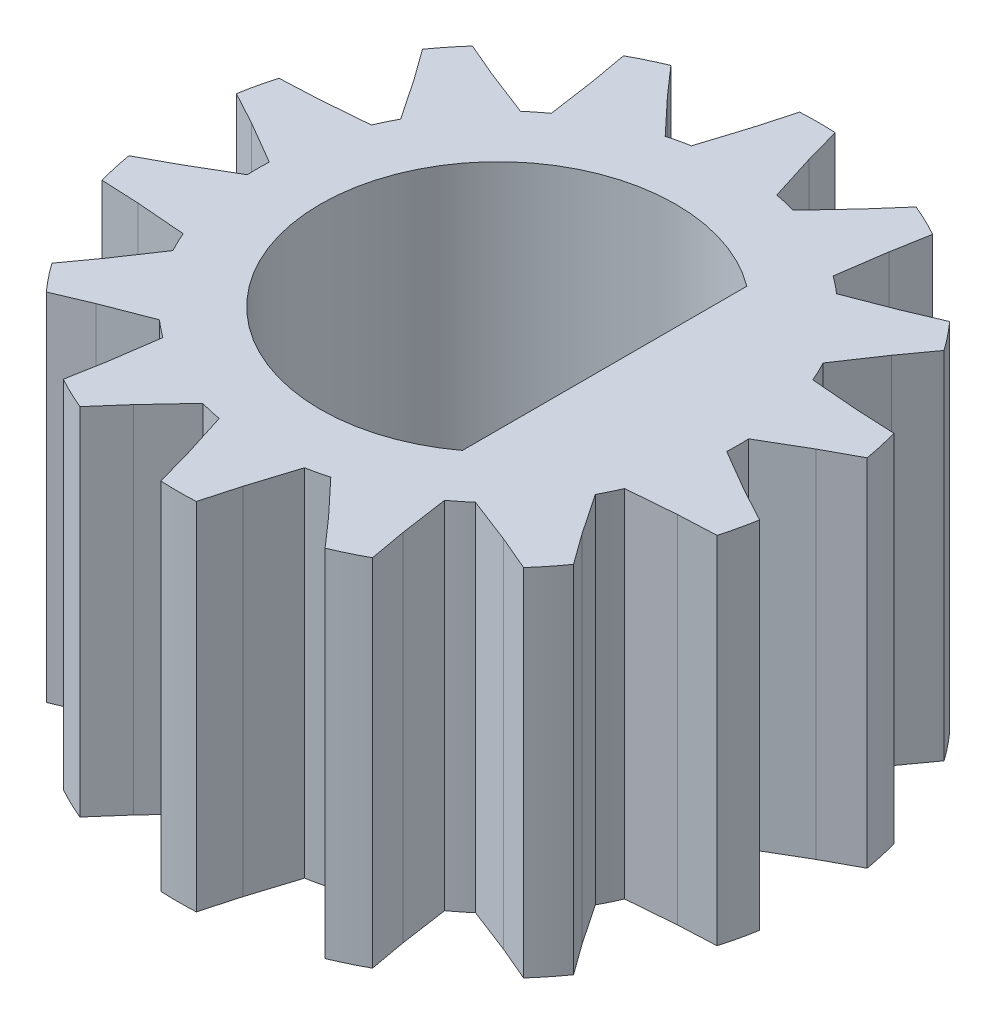
from build123d import *

# Parameters (mm, degrees)
BOSS_EXTRUDE1_DEPTH = 5
CIRPATTERN1_DEPTH   = 5


# Read off the part's stored shape, not the designer's step: CirPattern1
with BuildPart() as part:
    # Sketch2 → Boss-Extrude1 (new body)
    with BuildSketch(Plane(origin=(0, 0, 0), x_dir=(1, 0, 0), z_dir=(0, 1, 0))):
        with BuildLine():
            Line((-0.3925, 3.98069639), (-0.6, 3.321238474))
            ThreePointArc((-0.6, 3.321238474), (0, -3.375), (0.6, 3.321238474))
            Line((0.6, 3.321238474), (0.3925, 3.98069639))
            Line((0.3925, 3.98069639), (0.25, 4.493050189))
            ThreePointArc((0.25, 4.493050189), (0, 4.5), (-0.25, 4.493050189))
            Line((-0.25, 4.493050189), (-0.3925, 3.98069639))
        make_face()
        with BuildLine():
            Line((1.5, 2), (1.5, -2))
            ThreePointArc((1.5, -2), (-2.5, 0), (1.5, 2))
        make_face(mode=Mode.SUBTRACT)
    extrude(amount=BOSS_EXTRUDE1_DEPTH)

    # CirPattern1 outline → CirPattern1 (add)
    with BuildSketch(Plane(origin=(0, 0, 0), x_dir=(1, 0, 0), z_dir=(0, 1, 0))):
        with BuildLine():
            Line((1.724219199, 4.156569277), (1.373529153, 3.756782888))
            Line((1.373529153, 3.756782888), (0.900450047, 3.252662711))
            ThreePointArc((0.900450047, 3.252662711), (1.46435762, 3.040769929), (1.981612688, 2.732002224))
            Line((1.981612688, 2.732002224), (2.080789715, 3.416184152))
            Line((2.080789715, 3.416184152), (2.174703633, 3.939627407))
            ThreePointArc((2.174703633, 3.939627407), (1.952476826, 4.054359906), (1.724219199, 4.156569277))
        make_face()
        with BuildLine():
            Line((-2.080789715, 3.416184152), (-1.981612688, 2.732002224))
            ThreePointArc((-1.981612688, 2.732002224), (-1.46435762, 3.040769929), (-0.900450047, 3.252662711))
            Line((-0.900450047, 3.252662711), (-1.373529153, 3.756782888))
            Line((-1.373529153, 3.756782888), (-1.724219199, 4.156569277))
            ThreePointArc((-1.724219199, 4.156569277), (-1.952476826, 4.054359906), (-2.174703633, 3.939627407))
            Line((-2.174703633, 3.939627407), (-2.080789715, 3.416184152))
        make_face()
        with BuildLine():
            Line((-3.356953507, 2.175054747), (-2.970742681, 1.601659428))
            ThreePointArc((-2.970742681, 1.601659428), (-2.638681254, 2.104278081), (-2.222554919, 2.539857207))
            Line((-2.222554919, 2.539857207), (-2.867514013, 2.78879246))
            Line((-2.867514013, 2.78879246), (-3.35693564, 2.996828843))
            ThreePointArc((-3.35693564, 2.996828843), (-3.518241671, 2.805704108), (-3.66868054, 2.605913101))
            Line((-3.66868054, 2.605913101), (-3.356953507, 2.175054747))
        make_face()
        with BuildLine():
            Line((-3.968231487, 0.503129073), (-3.371480652, 0.15408834))
            ThreePointArc((-3.371480652, 0.15408834), (-3.290381704, 0.751008152), (-3.104455531, 1.324001834))
            Line((-3.104455531, 1.324001834), (-3.793552554, 1.268447484))
            Line((-3.793552554, 1.268447484), (-4.324769807, 1.243529702))
            ThreePointArc((-4.324769807, 1.243529702), (-4.387175605, 1.001344203), (-4.436030273, 0.756065746))
            Line((-4.436030273, 0.756065746), (-3.968231487, 0.503129073))
        make_face()
        with BuildLine():
            Line((-3.793552554, -1.268447484), (-3.104455531, -1.324001834))
            ThreePointArc((-3.104455531, -1.324001834), (-3.290381704, -0.751008152), (-3.371480652, -0.15408834))
            Line((-3.371480652, -0.15408834), (-3.968231487, -0.503129073))
            Line((-3.968231487, -0.503129073), (-4.436030273, -0.756065746))
            ThreePointArc((-4.436030273, -0.756065746), (-4.387175605, -1.001344203), (-4.324769807, -1.243529702))
            Line((-4.324769807, -1.243529702), (-3.793552554, -1.268447484))
        make_face()
        with BuildLine():
            Line((-2.867514013, -2.78879246), (-2.222554919, -2.539857207))
            ThreePointArc((-2.222554919, -2.539857207), (-2.638681254, -2.104278081), (-2.970742681, -1.601659428))
            Line((-2.970742681, -1.601659428), (-3.356953507, -2.175054747))
            Line((-3.356953507, -2.175054747), (-3.66868054, -2.605913101))
            ThreePointArc((-3.66868054, -2.605913101), (-3.518241671, -2.805704108), (-3.35693564, -2.996828843))
            Line((-3.35693564, -2.996828843), (-2.867514013, -2.78879246))
        make_face()
        with BuildLine():
            Line((-1.373529153, -3.756782888), (-0.900450047, -3.252662711))
            ThreePointArc((-0.900450047, -3.252662711), (-1.46435762, -3.040769929), (-1.981612688, -2.732002224))
            Line((-1.981612688, -2.732002224), (-2.080789715, -3.416184152))
            Line((-2.080789715, -3.416184152), (-2.174703633, -3.939627407))
            ThreePointArc((-2.174703633, -3.939627407), (-1.952476826, -4.054359906), (-1.724219199, -4.156569277))
            Line((-1.724219199, -4.156569277), (-1.373529153, -3.756782888))
        make_face()
        with BuildLine():
            Line((0.3925, -3.98069639), (0.6, -3.321238474))
            ThreePointArc((0.6, -3.321238474), (0, -3.375), (-0.6, -3.321238474))
            Line((-0.6, -3.321238474), (-0.3925, -3.98069639))
            Line((-0.3925, -3.98069639), (-0.25, -4.493050189))
            ThreePointArc((-0.25, -4.493050189), (0, -4.5), (0.25, -4.493050189))
            Line((0.25, -4.493050189), (0.3925, -3.98069639))
        make_face()
        with BuildLine():
            Line((2.080789715, -3.416184152), (1.981612688, -2.732002224))
            ThreePointArc((1.981612688, -2.732002224), (1.46435762, -3.040769929), (0.900450047, -3.252662711))
            Line((0.900450047, -3.252662711), (1.373529153, -3.756782888))
            Line((1.373529153, -3.756782888), (1.724219199, -4.156569277))
            ThreePointArc((1.724219199, -4.156569277), (1.952476826, -4.054359906), (2.174703633, -3.939627407))
            Line((2.174703633, -3.939627407), (2.080789715, -3.416184152))
        make_face()
        with BuildLine():
            Line((3.356953507, -2.175054747), (2.970742681, -1.601659428))
            ThreePointArc((2.970742681, -1.601659428), (2.638681254, -2.104278081), (2.222554919, -2.539857207))
            Line((2.222554919, -2.539857207), (2.867514013, -2.78879246))
            Line((2.867514013, -2.78879246), (3.35693564, -2.996828843))
            ThreePointArc((3.35693564, -2.996828843), (3.518241671, -2.805704108), (3.66868054, -2.605913101))
            Line((3.66868054, -2.605913101), (3.356953507, -2.175054747))
        make_face()
        with BuildLine():
            Line((3.968231487, -0.503129073), (3.371480652, -0.15408834))
            ThreePointArc((3.371480652, -0.15408834), (3.290381704, -0.751008152), (3.104455531, -1.324001834))
            Line((3.104455531, -1.324001834), (3.793552554, -1.268447484))
            Line((3.793552554, -1.268447484), (4.324769807, -1.243529702))
            ThreePointArc((4.324769807, -1.243529702), (4.387175605, -1.001344203), (4.436030273, -0.756065746))
            Line((4.436030273, -0.756065746), (3.968231487, -0.503129073))
        make_face()
        with BuildLine():
            Line((3.793552554, 1.268447484), (3.104455531, 1.324001834))
            ThreePointArc((3.104455531, 1.324001834), (3.290381704, 0.751008152), (3.371480652, 0.15408834))
            Line((3.371480652, 0.15408834), (3.968231487, 0.503129073))
            Line((3.968231487, 0.503129073), (4.436030273, 0.756065746))
            ThreePointArc((4.436030273, 0.756065746), (4.387175605, 1.001344203), (4.324769807, 1.243529702))
            Line((4.324769807, 1.243529702), (3.793552554, 1.268447484))
        make_face()
        with BuildLine():
            Line((2.867514013, 2.78879246), (2.222554919, 2.539857207))
            ThreePointArc((2.222554919, 2.539857207), (2.638681254, 2.104278081), (2.970742681, 1.601659428))
            Line((2.970742681, 1.601659428), (3.356953507, 2.175054747))
            Line((3.356953507, 2.175054747), (3.66868054, 2.605913101))
            ThreePointArc((3.66868054, 2.605913101), (3.518241671, 2.805704108), (3.35693564, 2.996828843))
            Line((3.35693564, 2.996828843), (2.867514013, 2.78879246))
        make_face()
    extrude(amount=CIRPATTERN1_DEPTH)


solid = part.part
